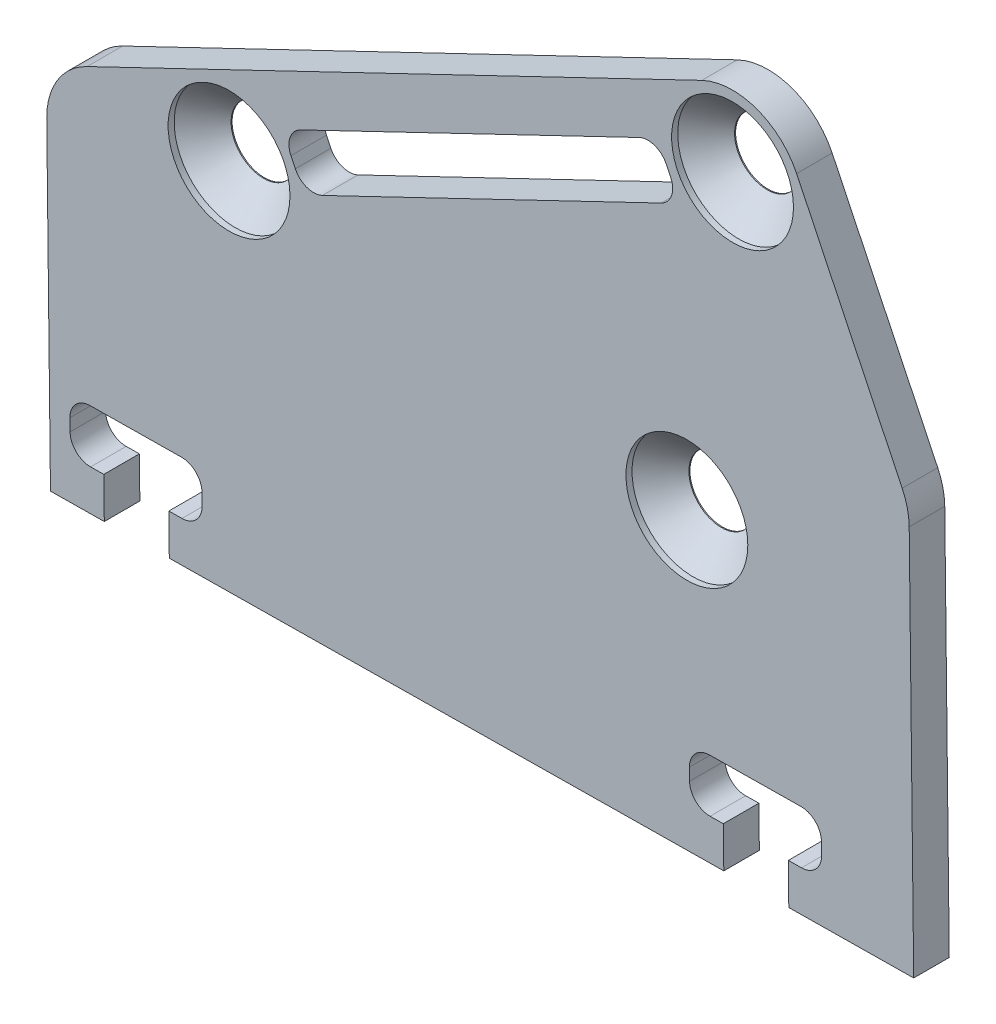
from build123d import *

# Parameters (mm, degrees)
SKETCH2_R           = 1.6
SKETCH2_R_2         = 3.5
BOSS_EXTRUDE1_DEPTH = 1.75
SKETCH3_R           = 3
CUT_EXTRUDE2_DEPTH  = 0.3
CHAMFER1_SIZE       = 1.4


with BuildPart() as part:
    # Sketch2 → Boss-Extrude1 (new body)
    # profile 1 of 4: a face of its own
    with BuildSketch(Plane(origin=(277.94406545, -368.782269, 0), x_dir=(0.99993266408239, 0.011604624125499034, 0), z_dir=(0, 0, 1))):
        with BuildLine():
            Line((-273.645770216, 387.793792834), (-273.645770216, 371.982873115))
            Line((-273.645770216, 371.982873115), (-270.995770216, 371.982873115))
            Line((-270.995770216, 371.982873115), (-270.995770216, 373.982873115))
            Line((-270.995770216, 373.982873115), (-271.645770216, 373.982873115))
            ThreePointArc((-271.645770216, 373.982873115), (-272.352876997, 374.275766334), (-272.645770216, 374.982873115))
            Line((-272.645770216, 374.982873115), (-272.645770216, 375.582873115))
            ThreePointArc((-272.645770216, 375.582873115), (-272.352876997, 376.289979896), (-271.645770216, 376.582873115))
            Line((-271.645770216, 376.582873115), (-267.145770216, 376.582873115))
            ThreePointArc((-267.145770216, 376.582873115), (-266.438663434, 376.289979896), (-266.145770216, 375.582873115))
            Line((-266.145770216, 375.582873115), (-266.145770216, 374.982873115))
            ThreePointArc((-266.145770216, 374.982873115), (-266.438663434, 374.275766334), (-267.145770216, 373.982873115))
            Line((-267.145770216, 373.982873115), (-267.795770216, 373.982873115))
            Line((-267.795770216, 373.982873115), (-267.795770216, 371.982873115))
            Line((-267.795770216, 371.982873115), (-240.495770216, 371.982873115))
            Line((-240.495770216, 371.982873115), (-240.495770216, 373.982873115))
            Line((-240.495770216, 373.982873115), (-241.145770216, 373.982873115))
            ThreePointArc((-241.145770216, 373.982873115), (-241.852876997, 374.275766334), (-242.145770216, 374.982873115))
            Line((-242.145770216, 374.982873115), (-242.145770216, 375.582873115))
            ThreePointArc((-242.145770216, 375.582873115), (-241.852876997, 376.289979896), (-241.145770216, 376.582873115))
            Line((-241.145770216, 376.582873115), (-236.645770216, 376.582873115))
            ThreePointArc((-236.645770216, 376.582873115), (-235.938663434, 376.289979896), (-235.645770216, 375.582873115))
            Line((-235.645770216, 375.582873115), (-235.645770216, 374.982873115))
            ThreePointArc((-235.645770216, 374.982873115), (-235.938663434, 374.275766334), (-236.645770216, 373.982873115))
            Line((-236.645770216, 373.982873115), (-237.295770216, 373.982873115))
            Line((-237.295770216, 373.982873115), (-237.295770216, 371.982873115))
            Line((-237.295770216, 371.982873115), (-231.145770216, 371.982873115))
            Line((-231.145770216, 371.982873115), (-231.145770216, 391.107179671))
            ThreePointArc((-231.145770216, 391.107179671), (-238.062806241, 390.349641022), (-231.473692961, 392.586343587))
            Line((-231.473692961, 392.586343587), (-236.545112102, 403.462037031))
            ThreePointArc((-236.545112102, 403.462037031), (-236.300153332, 402.740411764), (-236.217189356, 401.982873115))
            ThreePointArc((-236.217189356, 401.982873115), (-238.959651202, 398.565836981), (-242.889267039, 400.503710116))
            ThreePointArc((-242.889267039, 400.503710116), (-243.006113356, 403.179944092), (-241.196353273, 405.15495037))
            Line((-241.196353273, 405.15495037), (-271.624933816, 390.965870235))
            ThreePointArc((-271.624933816, 390.965870235), (-268.26522144, 390.745662801), (-266.645770216, 387.793792834))
            ThreePointArc((-266.645770216, 387.793792834), (-270.145770216, 384.293792834), (-273.645770216, 387.793792834))
        make_face()
        with Locations(Location((-242.145770216, 386.482873115, 0), (0, 0, 359.335089091))):
            Circle(SKETCH2_R, mode=Mode.SUBTRACT)
        with Locations(Location((-264.6406535, 390.360870917, 0), (0, 0, 359.335089091))):
            Circle(SKETCH2_R, mode=Mode.SUBTRACT)
        with BuildLine():
            Line((-242.994921177, 400.730286146), (-242.889267039, 400.503710116))
            Line((-242.889267039, 400.503710116), (-242.783612046, 400.277132252))
            ThreePointArc((-242.783612046, 400.277132252), (-242.750227212, 399.512493847), (-243.267301571, 398.948206203))
            Line((-243.267301571, 398.948206203), (-260.033995631, 391.129768361))
            ThreePointArc((-260.033995631, 391.129768361), (-260.798634036, 391.096383528), (-261.36292168, 391.613457887))
            Line((-261.36292168, 391.613457887), (-261.574230811, 392.06661178))
            ThreePointArc((-261.574230811, 392.06661178), (-261.607615645, 392.831250185), (-261.090541285, 393.395537829))
            Line((-261.090541285, 393.395537829), (-244.323847225, 401.213975671))
            ThreePointArc((-244.323847225, 401.213975671), (-243.55920882, 401.247360505), (-242.994921177, 400.730286146))
        make_face(mode=Mode.SUBTRACT)
    # profile 2 of 4: a face of its own
    with BuildSketch(Plane(origin=(277.94406545, -368.782269, 0), x_dir=(0.99993266408239, 0.011604624125499034, 0), z_dir=(0, 0, 1))):
        with Locations((-270.145770216, 387.793792834)):
            Circle(SKETCH2_R_2)
    # profile 3 of 4: a face of its own
    with BuildSketch(Plane(origin=(277.94406545, -368.782269, 0), x_dir=(0.99993266408239, 0.011604624125499034, 0), z_dir=(0, 0, 1))):
        with Locations((-234.645770216, 391.107179671)):
            Circle(SKETCH2_R_2)
    # profile 4 of 4: a face of its own
    with BuildSketch(Plane(origin=(277.94406545, -368.782269, 0), x_dir=(0.99993266408239, 0.011604624125499034, 0), z_dir=(0, 0, 1))):
        with Locations((-239.717189356, 401.982873115)):
            Circle(SKETCH2_R_2)
        with Locations(Location((-239.717189356, 401.982873115, 0), (0, 0, 359.335089091))):
            Circle(SKETCH2_R, mode=Mode.SUBTRACT)
    extrude(amount=BOSS_EXTRUDE1_DEPTH)

    # Sketch3 → Cut-Extrude2 (cut)
    with BuildSketch(Plane.XY.offset(1.75)):
        with Locations((8.791240591, 18.481261297)):
            Circle(SKETCH3_R)
        with Locations((31.329611869, 14.864569289)):
            Circle(SKETCH3_R)
        with Locations((33.578157523, 30.39170835)):
            Circle(SKETCH3_R)
    extrude(amount=-CUT_EXTRUDE2_DEPTH, mode=Mode.SUBTRACT)

    # Chamfer1
    chamfer1_edges = [part.edges().sort_by_distance(p)[0] for p in [
        (7.191240591, 18.481261297, 1.45),
        (29.729611869, 14.864569289, 1.45),
        (31.978157523, 30.39170835, 1.45),
    ]]
    chamfer(chamfer1_edges, length=CHAMFER1_SIZE - 0.0001)  # a hair under: the kernel refuses the full size


solid = part.part
